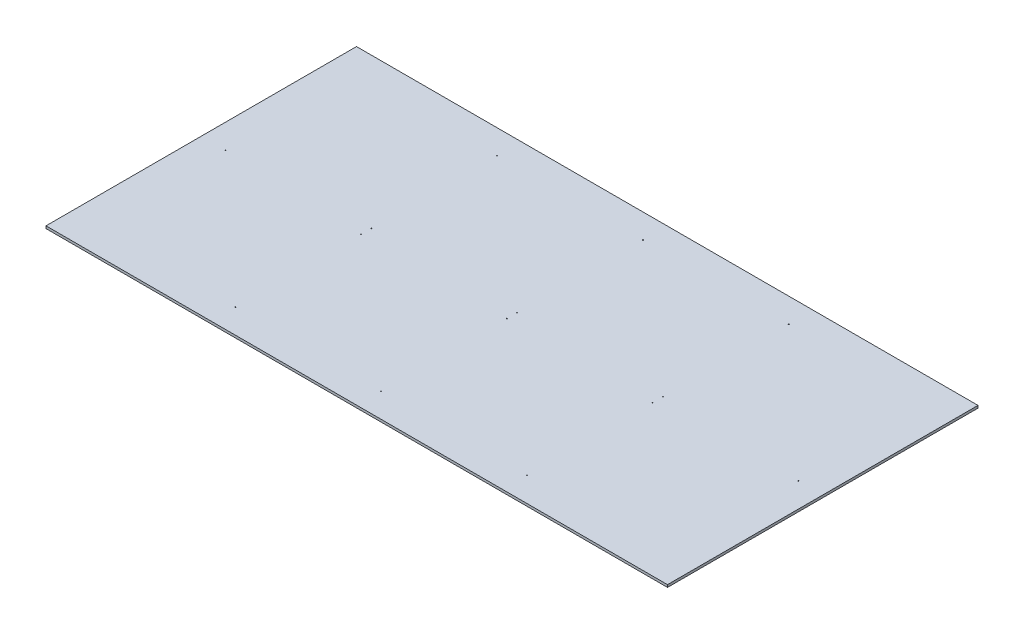
from build123d import *

# Parameters (mm, degrees)
SKETCH1_W                    = 255.8
SKETCH1_H                    = 127.8
BOSS_EXTRUDE1_DEPTH          = 1
F_0_35_0_35_DIAMETER_HOLE1_D = 0.35


with BuildPart() as part:
    # Sketch1 → Boss-Extrude1 (new body)
    with BuildSketch(Plane(origin=(0, 0, 0), x_dir=(1, 0, 0), z_dir=(0, 1, 0))):
        Rectangle(SKETCH1_W, SKETCH1_H)
    extrude(amount=BOSS_EXTRUDE1_DEPTH)

    # Ø0.35 (0.35) Diameter Hole1 (through all)
    with Locations(Plane(origin=(0, 1, 0), x_dir=(1, 0, 0), z_dir=(0, 1, 0))):
        with Locations((-117.875, 0), (-60, 2.125), (-60, 53.875), (117.875, 0), (60, 2.125), (60, 53.875), (0, 2.125), (0, 53.875), (60, -2.125), (60, -53.875), (0, -2.125), (0, -53.875), (-60, -2.125), (-60, -53.875)):
            Hole(F_0_35_0_35_DIAMETER_HOLE1_D / 2)


solid = part.part
